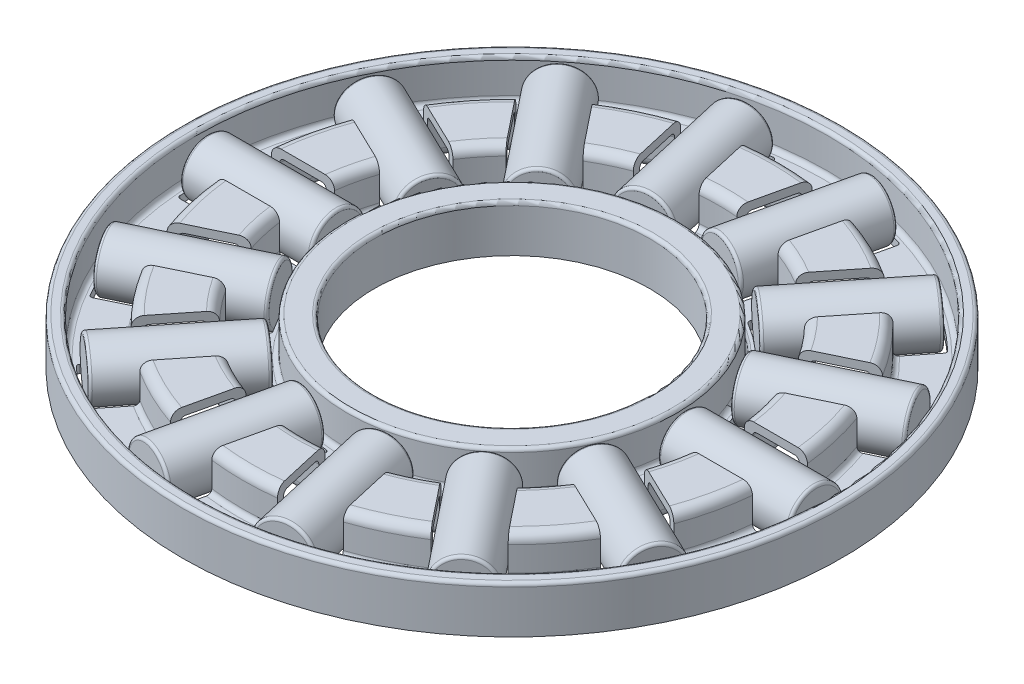
from build123d import *

# Parameters (mm, degrees)
FILLET1_R                = 0.338461538
FILLET2_R                = 0.338461538
FILLET3_R                = 0.125
FILLET4_R                = 0.169230769
CUT_EXTRUDE1_DEPTH       = 17.991836351
FILLET5_R                = 0.100132749
CIRPATTERN1_COUNT        = 14
FILLET5_OF_CIRPATTERN1_R = 0.100132749
SKETCH5_W                = 4.777109468
SKETCH5_H                = 1
FILLET6_R                = 0.100132749
CIRPATTERN2_COUNT        = 14


with BuildPart() as part:
    # Sketch3 → Revolve1 (revolve)
    with BuildSketch(Plane(origin=(0, 0, 0), x_dir=(0, 0, -1), z_dir=(1, 0, 0))):
        Polygon((5.341666667, -0.85), (5.341666667, 0.557211538), (5.670833333, 0.557211538), (5.670833333, -0.85), (7.822596154, -0.85), (7.822596154, 0.557211538), (9.514903846, 0.557211538), (9.514903846, -0.85), (11.666666667, -0.85), (11.666666667, 0.557211538), (11.833333333, 0.557211538), (11.833333333, -0.85), (12, -0.85), (12, 0.85), (11.5, 0.85), (11.5, -0.557211538), (9.807692308, -0.557211538), (9.807692308, 0.85), (7.529807692, 0.85), (7.529807692, -0.557211538), (6, -0.557211538), (6, 0.85), (5.0125, 0.85), (5.0125, -0.85), align=None)
    revolve(axis=Axis((0, 1, 0), (0, -1, 0)))

    # Fillet1
    fillet1_edges = [part.edges().sort_by_distance(p)[0] for p in [
        (0, -0.85, 9.514903846),
        (0, -0.85, 11.666666667),
        (0, -0.85, 5.670833333),
        (0, -0.85, 7.822596154),
    ]]
    fillet(fillet1_edges, radius=FILLET1_R)

    # Fillet2
    fillet2_edges = [part.edges().sort_by_distance(p)[0] for p in [
        (0, 0.85, 9.807692308),
        (0, 0.85, 7.529807692),
    ]]
    fillet(fillet2_edges, radius=FILLET2_R)

    # Fillet3
    fillet3_edges = [part.edges().sort_by_distance(p)[0] for p in [
        (0, 0.85, 11.5),
        (0, 0.85, 12),
        (0, 0.85, 6),
        (0, 0.85, 5.0125),
    ]]
    fillet(fillet3_edges, radius=FILLET3_R)

    # Fillet4
    fillet4_edges = [part.edges().sort_by_distance(p)[0] for p in [
        (0, 0.557211538, 7.822596154),
        (0, 0.557211538, 9.514903846),
        (0, -0.557211538, 11.5),
        (0, -0.557211538, 9.807692308),
        (0, -0.557211538, 7.529807692),
        (0, -0.557211538, 6),
    ]]
    fillet(fillet4_edges, radius=FILLET4_R)

    # Sketch4 → Cut-Extrude1 (cut, symmetric)
    with BuildSketch(Plane(origin=(0, 0, 0), x_dir=(1, 0, 0), z_dir=(0, 1, 0))):
        with BuildLine():
            Line((6.194806292, 1), (11.180367838, 1))
            ThreePointArc((11.180367838, 1), (11.225, 0), (11.180367838, -1))
            Line((11.180367838, -1), (6.194806292, -1))
            ThreePointArc((6.194806292, -1), (6.275, 0), (6.194806292, 1))
        make_face()
    cut_extrude1 = extrude(amount=CUT_EXTRUDE1_DEPTH, both=True, mode=Mode.SUBTRACT)

    # Fillet5
    fillet5_edges = [part.edges().sort_by_distance(p)[0] for p in [
        (11.180367838, -0.703605769, -1),
        (11.180367838, -0.703605769, 1),
        (6.194806292, -0.703605769, -1),
        (6.194806292, -0.703605769, 1),
    ]]
    fillet(fillet5_edges, radius=FILLET5_R)

    # CirPattern1: Cut-Extrude1 ×14 about axis
    cirpattern1_axis = Axis((0, 1, 0), (0, -1, 0))
    for i in range(1, CIRPATTERN1_COUNT):
        add(cut_extrude1.rotate(cirpattern1_axis, i * 360 / CIRPATTERN1_COUNT), mode=Mode.SUBTRACT)

    # Fillet5 of CirPattern1
    fillet5_of_cirpattern1_edges = [part.edges().sort_by_distance(p)[0] for p in [
        (10.507047093, -0.703605769, 3.950010934),
        (9.639279615, -0.703605769, 5.75194867),
        (6.015211351, -0.703605769, 1.786856849),
        (5.147443873, -0.703605769, 3.588794585),
        (7.752676811, -0.703605769, 8.11767376),
        (6.189013846, -0.703605769, 9.364653363),
        (4.64423003, -0.703605769, 4.219804785),
        (3.080567065, -0.703605769, 5.466784389),
        (3.462793806, -0.703605769, 10.67753174),
        (1.512937981, -0.703605769, 11.122573608),
        (2.353401994, -0.703605769, 5.816968631),
        (0.40354617, -0.703605769, 6.262010499),
        (-1.512937981, -0.703605769, 11.122573608),
        (-3.462793806, -0.703605769, 10.67753174),
        (-0.40354617, -0.703605769, 6.262010499),
        (-2.353401994, -0.703605769, 5.816968631),
        (-6.189013846, -0.703605769, 9.364653363),
        (-7.752676811, -0.703605769, 8.11767376),
        (-3.080567065, -0.703605769, 5.466784389),
        (-4.64423003, -0.703605769, 4.219804785),
        (-9.639279615, -0.703605769, 5.75194867),
        (-10.507047093, -0.703605769, 3.950010934),
        (-5.147443873, -0.703605769, 3.588794585),
        (-6.015211351, -0.703605769, 1.786856849),
        (-11.180367838, -0.703605769, 1),
        (-11.180367838, -0.703605769, -1),
        (-6.194806292, -0.703605769, 1),
        (-6.194806292, -0.703605769, -1),
        (-10.507047093, -0.703605769, -3.950010934),
        (-9.639279615, -0.703605769, -5.75194867),
        (-6.015211351, -0.703605769, -1.786856849),
        (-5.147443873, -0.703605769, -3.588794585),
        (-7.752676811, -0.703605769, -8.11767376),
        (-6.189013846, -0.703605769, -9.364653363),
        (-4.64423003, -0.703605769, -4.219804785),
        (-3.080567065, -0.703605769, -5.466784389),
        (-3.462793806, -0.703605769, -10.67753174),
        (-1.512937981, -0.703605769, -11.122573608),
        (-2.353401994, -0.703605769, -5.816968631),
        (-0.40354617, -0.703605769, -6.262010499),
        (1.512937981, -0.703605769, -11.122573608),
        (3.462793806, -0.703605769, -10.67753174),
        (0.40354617, -0.703605769, -6.262010499),
        (2.353401994, -0.703605769, -5.816968631),
        (6.189013846, -0.703605769, -9.364653363),
        (7.752676811, -0.703605769, -8.11767376),
        (3.080567065, -0.703605769, -5.466784389),
        (4.64423003, -0.703605769, -4.219804785),
        (9.639279615, -0.703605769, -5.75194867),
        (10.507047093, -0.703605769, -3.950010934),
        (5.147443873, -0.703605769, -3.588794585),
        (6.015211351, -0.703605769, -1.786856849),
    ]]
    fillet(fillet5_of_cirpattern1_edges, radius=FILLET5_OF_CIRPATTERN1_R)


with BuildPart() as body_2:
    # Sketch5 → Revolve2 (revolve)
    with BuildSketch(Plane(origin=(0, 0, 0), x_dir=(1, 0, 0), z_dir=(0, 1, 0))):
        with Locations((8.699858601, 0.5)):
            Rectangle(SKETCH5_W, SKETCH5_H)
    revolve(axis=Axis((11.225, 0, 0), (-1, 0, 0)))

    # Fillet6
    fillet6_edges = [body_2.edges().sort_by_distance(p)[0] for p in [
        (6.311303867, 0, 1),
        (11.088413335, 0, 1),
    ]]
    fillet(fillet6_edges, radius=FILLET6_R)


with BuildPart() as cirpattern2_1:
    # CirPattern2: pattern copy
    add(body_2.part.rotate(Axis((0, 1, 0), (0, -1, 0)), 1 * 360 / CIRPATTERN2_COUNT))


with BuildPart() as cirpattern2_2:
    # CirPattern2: pattern copy
    add(body_2.part.rotate(Axis((0, 1, 0), (0, -1, 0)), 2 * 360 / CIRPATTERN2_COUNT))


with BuildPart() as cirpattern2_3:
    # CirPattern2: pattern copy
    add(body_2.part.rotate(Axis((0, 1, 0), (0, -1, 0)), 3 * 360 / CIRPATTERN2_COUNT))


with BuildPart() as cirpattern2_4:
    # CirPattern2: pattern copy
    add(body_2.part.rotate(Axis((0, 1, 0), (0, -1, 0)), 4 * 360 / CIRPATTERN2_COUNT))


with BuildPart() as cirpattern2_5:
    # CirPattern2: pattern copy
    add(body_2.part.rotate(Axis((0, 1, 0), (0, -1, 0)), 5 * 360 / CIRPATTERN2_COUNT))


with BuildPart() as cirpattern2_6:
    # CirPattern2: pattern copy
    add(body_2.part.rotate(Axis((0, 1, 0), (0, -1, 0)), 6 * 360 / CIRPATTERN2_COUNT))


with BuildPart() as cirpattern2_7:
    # CirPattern2: pattern copy
    add(body_2.part.rotate(Axis((0, 1, 0), (0, -1, 0)), 7 * 360 / CIRPATTERN2_COUNT))


with BuildPart() as cirpattern2_8:
    # CirPattern2: pattern copy
    add(body_2.part.rotate(Axis((0, 1, 0), (0, -1, 0)), 8 * 360 / CIRPATTERN2_COUNT))


with BuildPart() as cirpattern2_9:
    # CirPattern2: pattern copy
    add(body_2.part.rotate(Axis((0, 1, 0), (0, -1, 0)), 9 * 360 / CIRPATTERN2_COUNT))


with BuildPart() as cirpattern2_10:
    # CirPattern2: pattern copy
    add(body_2.part.rotate(Axis((0, 1, 0), (0, -1, 0)), 10 * 360 / CIRPATTERN2_COUNT))


with BuildPart() as cirpattern2_11:
    # CirPattern2: pattern copy
    add(body_2.part.rotate(Axis((0, 1, 0), (0, -1, 0)), 11 * 360 / CIRPATTERN2_COUNT))


with BuildPart() as cirpattern2_12:
    # CirPattern2: pattern copy
    add(body_2.part.rotate(Axis((0, 1, 0), (0, -1, 0)), 12 * 360 / CIRPATTERN2_COUNT))


with BuildPart() as cirpattern2_13:
    # CirPattern2: pattern copy
    add(body_2.part.rotate(Axis((0, 1, 0), (0, -1, 0)), 13 * 360 / CIRPATTERN2_COUNT))


solid = Compound([part.part, body_2.part, cirpattern2_1.part, cirpattern2_2.part, cirpattern2_3.part, cirpattern2_4.part, cirpattern2_5.part, cirpattern2_6.part, cirpattern2_7.part, cirpattern2_8.part, cirpattern2_9.part, cirpattern2_10.part, cirpattern2_11.part, cirpattern2_12.part, cirpattern2_13.part])
